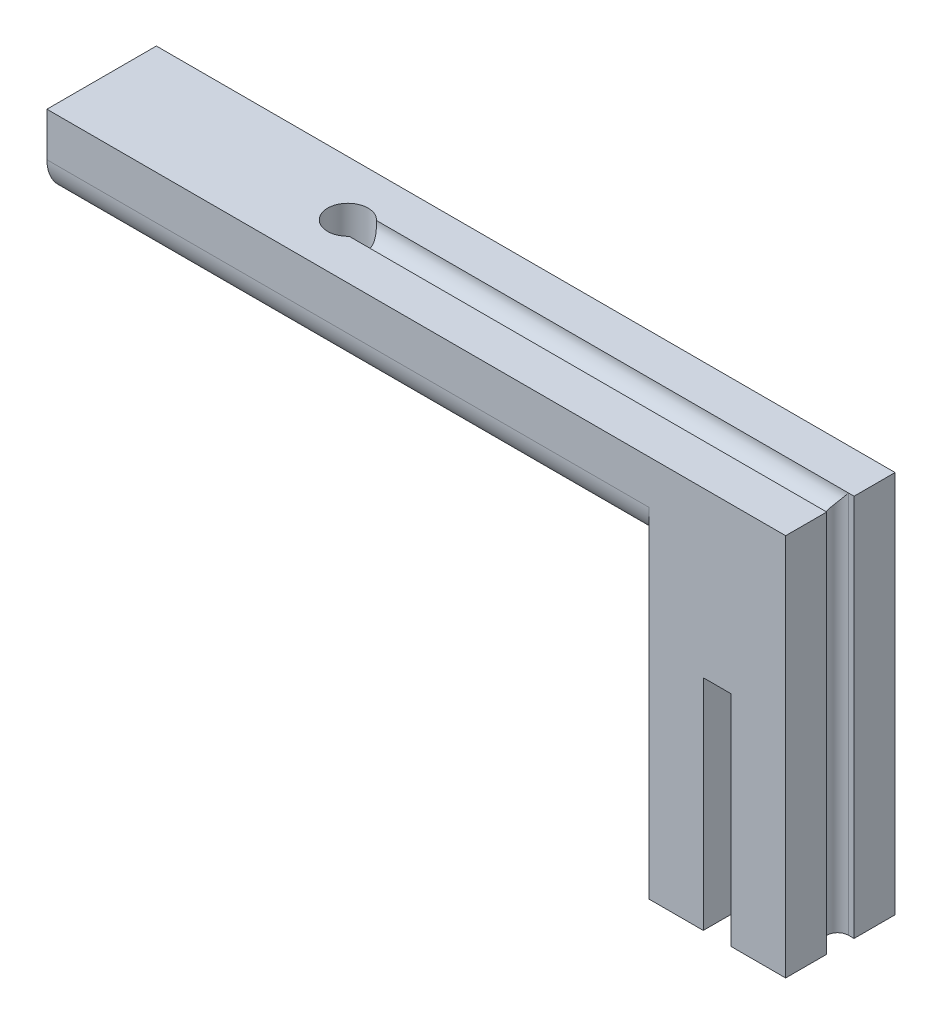
from build123d import *

# Parameters (mm, degrees)
BOSS_EXTRUDE1_DEPTH = 20
SKETCH2_W           = 5.1
SKETCH2_H           = 40
CUT_EXTRUDE1_DEPTH  = 20
FILLET1_R           = 7
CUT_EXTRUDE3_REACH  = 155.379
SKETCH5_R           = 3.7
SKETCH6_W           = 87.272363661
SKETCH6_H           = 5
CUT_EXTRUDE4_DEPTH  = 3
FILLET2_R           = 3
SKETCH7_W           = 3
SKETCH7_H           = 5
CUT_EXTRUDE5_DEPTH  = 70
FILLET3_R           = 2


with BuildPart() as part:
    # Sketch1 → Boss-Extrude1 (new body)
    with BuildSketch(Plane.XY):
        Polygon((0, 0), (0, 70), (-135, 70), (-135, 55), (-25, 55), (-25, 0), align=None)
    extrude(amount=BOSS_EXTRUDE1_DEPTH)

    # Sketch2 → Cut-Extrude1 (cut)
    with BuildSketch(Plane.XY.offset(20)):
        with Locations((-12.5, 20)):
            Rectangle(SKETCH2_W, SKETCH2_H)
    extrude(amount=-CUT_EXTRUDE1_DEPTH, mode=Mode.SUBTRACT)

    # Fillet1
    fillet1_edges = [part.edges().sort_by_distance(p)[0] for p in [
        (-80, 55, 20),
        (-80, 55, 0),
    ]]
    fillet(fillet1_edges, radius=FILLET1_R)

    # Cut-Extrude3: up to this face of the body (flat: up to its plane)
    cut_extrude3_end = Plane(part.part.faces().sort_by_distance((-80, 55, 10))[0])
    # Sketch5 → Cut-Extrude3 (cut, up to the picked face)
    with BuildSketch(Plane(origin=(0, 70, 0), x_dir=(1, 0, 0), z_dir=(0, 1, 0)), mode=Mode.PRIVATE) as cut_extrude3_sk1:
        with Locations(Location((-90, -10, 0), (0, 0, 180))):
            Circle(SKETCH5_R)
    cut_extrude3_tool1 = split(extrude(cut_extrude3_sk1.sketch, amount=-CUT_EXTRUDE3_REACH, mode=Mode.PRIVATE), bisect_by=cut_extrude3_end, keep=Keep.BOTH, mode=Mode.PRIVATE)
    add(cut_extrude3_tool1.solids().sort_by(Axis((-90, 70, 10), (0, -1, 0)))[0], mode=Mode.SUBTRACT)

    # Sketch6 → Cut-Extrude4 (cut)
    with BuildSketch(Plane(origin=(0, 70, 0), x_dir=(1, 0, 0), z_dir=(0, 1, 0))):
        with Locations((-43.63618183, -10)):
            Rectangle(SKETCH6_W, SKETCH6_H)
    extrude(amount=-CUT_EXTRUDE4_DEPTH, mode=Mode.SUBTRACT)

    # Fillet2
    # the kernel refuses this fillet: 3 mm, written as the material it adds along each edge
    with BuildSketch(Plane(origin=(0, 67, 12.5), x_dir=(0, 0, -1), z_dir=(-1, 0, 0))) as fillet2_piece_1_section:
        with BuildLine():
            CenterArc((FILLET2_R, -FILLET2_R), FILLET2_R, 90, 90)
            Line((0, -FILLET2_R), (0, 0))
            Line((0, 0), (FILLET2_R, 0))
        make_face()
    fillet2_piece_1 = extrude(amount=94.772363661, mode=Mode.PRIVATE)
    fillet2_piece_1 = fillet2_piece_1 - Plane(origin=(-90, 67.680644159, 10), x_dir=(-1, 0, 0), z_dir=(0, 1, 0)) * Cylinder(3.7, 202, mode=Mode.PRIVATE)
    add(fillet2_piece_1)
    with BuildSketch(Plane(origin=(-94.772363661, 67, 7.5), x_dir=(0, 1, 0), z_dir=(1, 0, 0))) as fillet2_piece_2_section:
        with BuildLine():
            CenterArc((FILLET2_R, FILLET2_R), FILLET2_R, 180, 90)
            Line((0, FILLET2_R), (0, 0))
            Line((0, 0), (FILLET2_R, 0))
        make_face()
    fillet2_piece_2 = extrude(amount=94.772363661, mode=Mode.PRIVATE)
    fillet2_piece_2 = fillet2_piece_2 - Plane(origin=(-90, 67.756833616, 10), x_dir=(-1, 0, 0), z_dir=(0, 1, 0)) * Cylinder(3.7, 202, mode=Mode.PRIVATE)
    add(fillet2_piece_2)

    # Sketch7 → Cut-Extrude5 (cut)
    with BuildSketch(Plane(origin=(0, 70, 0), x_dir=(1, 0, 0), z_dir=(0, 1, 0))):
        with Locations((-1.5, -10)):
            Rectangle(SKETCH7_W, SKETCH7_H)
    extrude(amount=-CUT_EXTRUDE5_DEPTH, mode=Mode.SUBTRACT)

    # Fillet3
    # the kernel refuses this fillet: 2 mm, written as the material it adds along each edge
    with BuildSketch(Plane(origin=(-3, 70, 12.5), x_dir=(0, 0, -1), z_dir=(0, -1, 0))) as fillet3_piece_1_section:
        with BuildLine():
            CenterArc((FILLET3_R, FILLET3_R), FILLET3_R, 180, 90)
            Line((0, FILLET3_R), (0, 0))
            Line((0, 0), (FILLET3_R, 0))
        make_face()
    fillet3_piece_1 = extrude(amount=70, mode=Mode.PRIVATE)
    fillet3_piece_1 = fillet3_piece_1 - Plane(origin=(-2.544196541, 70, 9.5), x_dir=(0, 0, -1), z_dir=(1, 0, 0)) * Cylinder(3, 148, mode=Mode.PRIVATE)
    add(fillet3_piece_1)
    with BuildSketch(Plane(origin=(-3, 70, 7.5), x_dir=(0, 0, 1), z_dir=(0, -1, 0))) as fillet3_piece_2_section:
        with BuildLine():
            CenterArc((FILLET3_R, -FILLET3_R), FILLET3_R, 90, 90)
            Line((0, -FILLET3_R), (0, 0))
            Line((0, 0), (FILLET3_R, 0))
        make_face()
    fillet3_piece_2 = extrude(amount=70, mode=Mode.PRIVATE)
    fillet3_piece_2 = fillet3_piece_2 - Plane(origin=(-2.544196926, 70, 10.5), x_dir=(0, 1, 0), z_dir=(-1, 0, 0)) * Cylinder(3, 148, mode=Mode.PRIVATE)
    add(fillet3_piece_2)


solid = part.part
